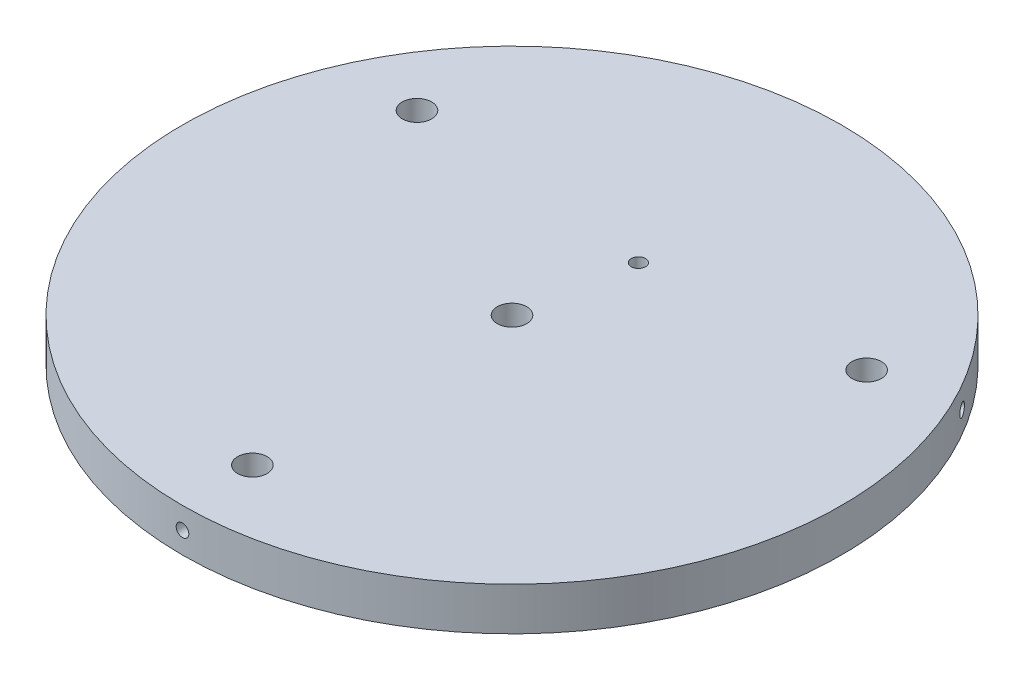
from build123d import *

# Parameters (mm, degrees)
SKETCH1_R               = 73.025
SKETCH1_R_2             = 3.2639
BOSS_EXTRUDE1_DEPTH     = 9.525
SKETCH4_R               = 1.397
CUT_EXTRUDE1_DEPTH      = 6.35
CIRPATTERN1_COUNT       = 3
CUT_EXTRUDE2_DEPTH      = 104.71126702
CUT_EXTRUDE2_DEPTH_BACK = 104.71126702
SKETCH5_R               = 1.5875


with BuildPart() as part:
    # Sketch1 → Boss-Extrude1 (new body)
    with BuildSketch(Plane(origin=(0, 0, 0), x_dir=(1, 0, 0), z_dir=(0, 1, 0))):
        Circle(SKETCH1_R)
        with Locations((-49.823307505, 28.7655)):
            Circle(SKETCH1_R_2, mode=Mode.SUBTRACT)
        with Locations((49.823307505, 28.7655)):
            Circle(SKETCH1_R_2, mode=Mode.SUBTRACT)
        with Locations((0, -57.531)):
            Circle(SKETCH1_R_2, mode=Mode.SUBTRACT)
        Circle(SKETCH1_R_2, mode=Mode.SUBTRACT)
    extrude(amount=BOSS_EXTRUDE1_DEPTH)

    # Sketch4 → Cut-Extrude1 (cut)
    with BuildSketch(Plane.XY.offset(73.025)):
        with Locations((0, 4.7625)):
            Circle(SKETCH4_R)
    cut_extrude1 = extrude(amount=-CUT_EXTRUDE1_DEPTH, mode=Mode.SUBTRACT)

    # CirPattern1: Cut-Extrude1 ×3 about axis
    cirpattern1_axis = Axis((0, 0, 0), (0, 1, 0))
    for i in range(1, CIRPATTERN1_COUNT):
        add(cut_extrude1.rotate(cirpattern1_axis, i * 360 / CIRPATTERN1_COUNT), mode=Mode.SUBTRACT)

    # Sketch5 → Cut-Extrude2 (cut, two sides: drawn at the far end of the back side and taken through both)
    with BuildSketch(Plane(origin=(0, 9.525, 0), x_dir=(1, 0, 0), z_dir=(0, 1, 0)).offset(-CUT_EXTRUDE2_DEPTH_BACK)):
        with Locations((3.918177901, 24.089251357)):
            Circle(SKETCH5_R)
    extrude(amount=CUT_EXTRUDE2_DEPTH + CUT_EXTRUDE2_DEPTH_BACK, mode=Mode.SUBTRACT)


solid = part.part
